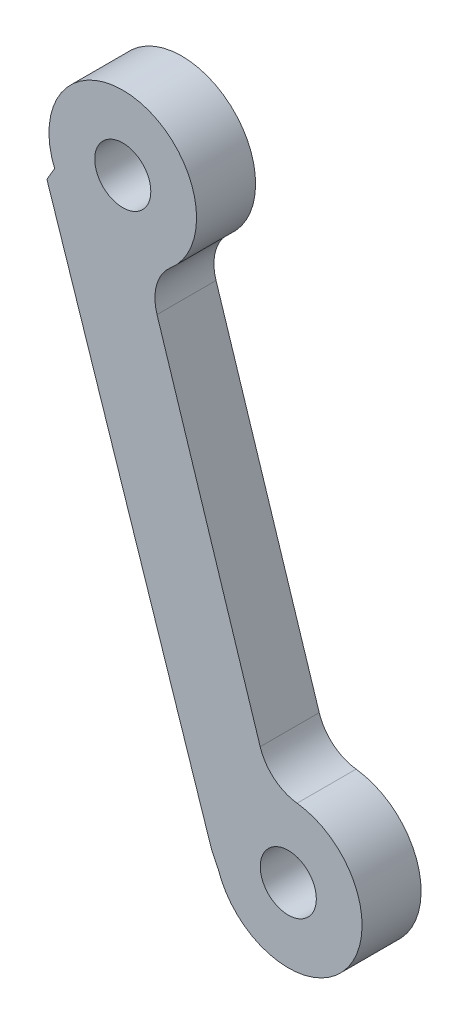
from build123d import *

# Parameters (mm, degrees)
SKETCH1_R           = 1.9
BOSS_EXTRUDE1_DEPTH = 4
FILLET2_R           = 3


with BuildPart() as part:
    # Sketch1 → Boss-Extrude1 (new body)
    with BuildSketch(Plane.XY):
        with BuildLine():
            Line((15.011053362, 49.830662375), (3.838692378, 83.622901822))
            Line((3.838692378, 83.622901822), (4.361186649, 84.509770663))
            ThreePointArc((4.361186649, 84.509770663), (11.04786713, 90.978220722), (10.57313596, 81.686979022))
            Line((10.57313596, 81.686979022), (18.898131325, 55.650415498))
            Line((18.898131325, 55.650415498), (18.969275223, 55.368960637))
            ThreePointArc((18.969275223, 55.368960637), (24.583713079, 48.126504338), (15.45509163, 48.928599175))
            Line((15.45509163, 48.928599175), (15.011053362, 49.830662375))
        make_face()
        with Locations((8.979351439, 86.426161535)):
            Circle(SKETCH1_R, mode=Mode.SUBTRACT)
        with Locations((20.194596002, 50.521426317)):
            Circle(SKETCH1_R, mode=Mode.SUBTRACT)
    extrude(amount=BOSS_EXTRUDE1_DEPTH)

    # Fillet2
    fillet2_edges = [part.edges().sort_by_distance(p)[0] for p in [
        (18.969275223, 55.368960637, 2),
        (10.57313596, 81.686979022, 2),
    ]]
    fillet(fillet2_edges, radius=FILLET2_R)


solid = part.part
